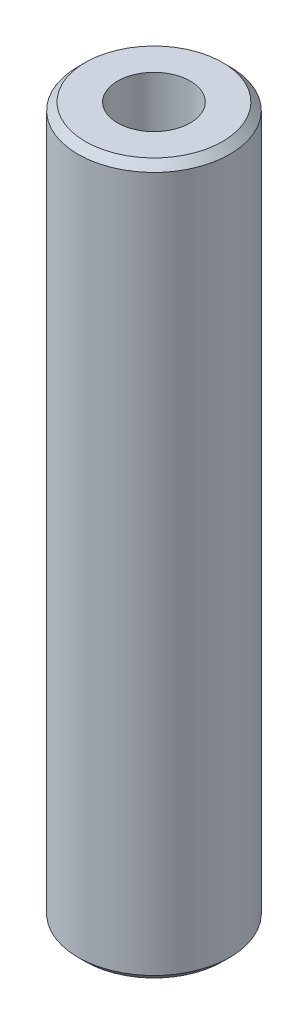
from build123d import *

# Parameters (mm, degrees)
SKETCH1_R           = 12.5
BOSS_EXTRUDE1_DEPTH = 116.931307703
SKETCH2_R           = 5.98408536
CUT_EXTRUDE1_DEPTH  = 119.260013196
CHAMFER1_SIZE       = 1.210693659


with BuildPart() as part:
    # Sketch1 → Boss-Extrude1 (new body)
    with BuildSketch(Plane(origin=(0, 0, 0), x_dir=(1, 0, 0), z_dir=(0, 1, 0))):
        Circle(SKETCH1_R)
    extrude(amount=BOSS_EXTRUDE1_DEPTH)

    # Sketch2 → Cut-Extrude1 (cut, through all)
    with BuildSketch(Plane(origin=(0, 0, 0), x_dir=(1, 0, 0), z_dir=(0, 1, 0))):
        Circle(SKETCH2_R)
    extrude(amount=CUT_EXTRUDE1_DEPTH, mode=Mode.SUBTRACT)

    # Chamfer1
    chamfer1_edges = [part.edges().sort_by_distance(p)[0] for p in [
        (-12.5, 116.931307703, 0),
        (-12.5, 0, 0),
    ]]
    chamfer(chamfer1_edges, length=CHAMFER1_SIZE)


solid = part.part
